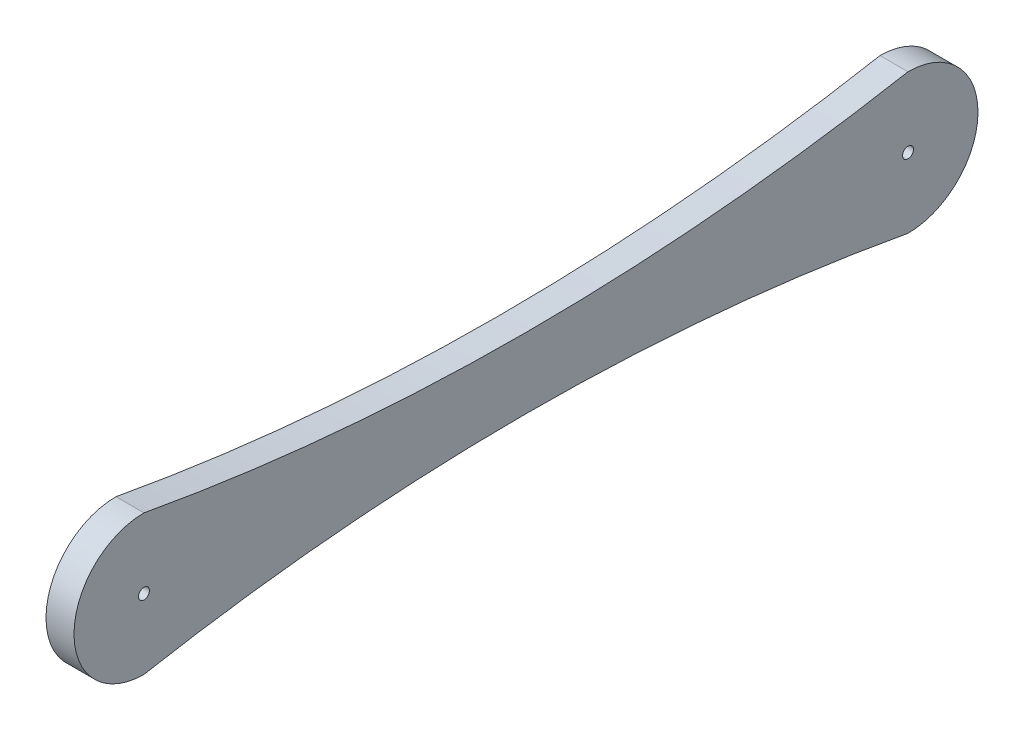
from build123d import *

# Parameters (mm, degrees)
SKETCH1_R           = 2.4892
BOSS_EXTRUDE1_DEPTH = 12.7


with BuildPart() as part:
    # Sketch1 → Boss-Extrude1 (new body)
    with BuildSketch(Plane(origin=(0, 0, 0), x_dir=(0, 0, -1), z_dir=(1, 0, 0))):
        with BuildLine():
            ThreePointArc((-173.355, 31.75), (-205.105, 0), (-173.355, -31.75))
            ThreePointArc((-173.355, -31.75), (0, -15.969504771), (173.355, -31.75))
            ThreePointArc((173.355, -31.75), (205.105, 0), (173.355, 31.75))
            ThreePointArc((173.355, 31.75), (0, 15.969504771), (-173.355, 31.75))
        make_face()
        with Locations((-173.355, 0)):
            Circle(SKETCH1_R, mode=Mode.SUBTRACT)
        with Locations((173.355, 0)):
            Circle(SKETCH1_R, mode=Mode.SUBTRACT)
    extrude(amount=BOSS_EXTRUDE1_DEPTH)


solid = part.part
